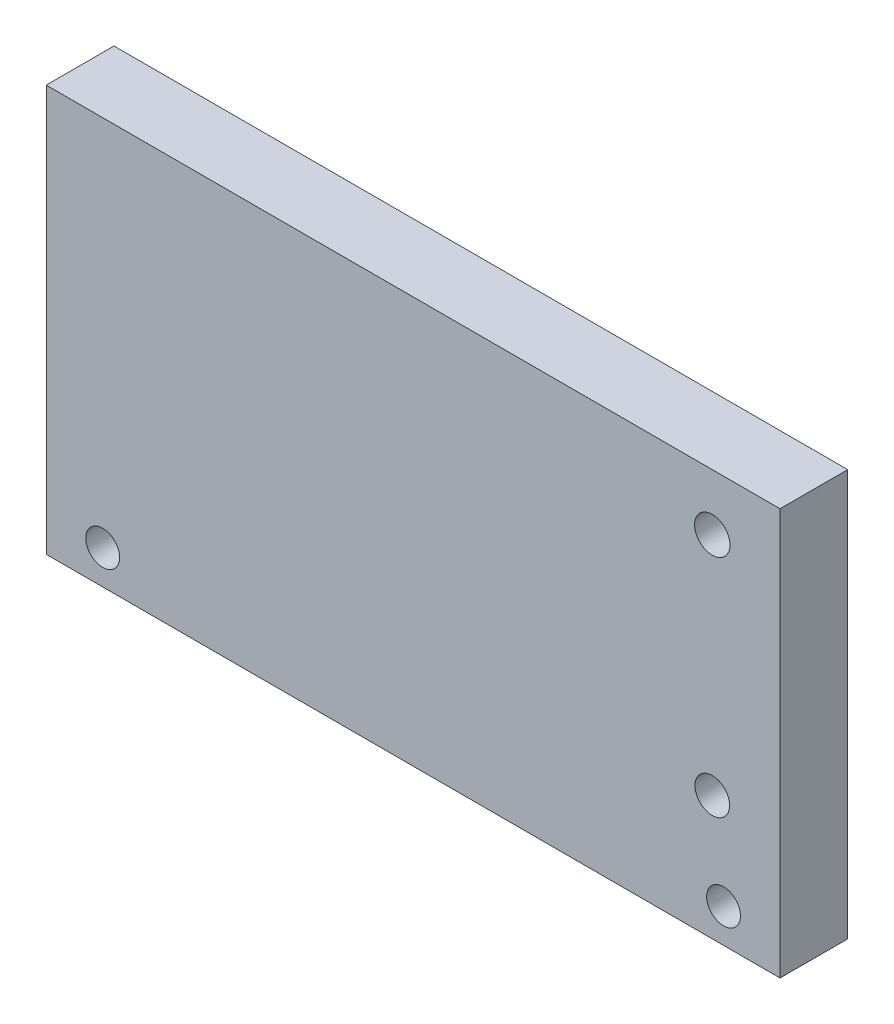
from build123d import *

# Parameters (mm, degrees)
ESQUISSE1_W             = 65
ESQUISSE1_H             = 36
ESQUISSE1_R             = 1.567190536
ESQUISSE1_R_2           = 1.534262692
BOSS_EXTRU_1_DEPTH      = 6
ESQUISSE3_R             = 1.5
ENL_V_MAT_EXTRU_1_DEPTH = 10


with BuildPart() as part:
    # Esquisse1 → Boss.-Extru.1 (new body)
    with BuildSketch(Plane.XY):
        with Locations((-7.771220945, 18.631944444)):
            Rectangle(ESQUISSE1_W, ESQUISSE1_H)
        with Locations((18.728779055, 31.631944444)):
            Circle(ESQUISSE1_R, mode=Mode.SUBTRACT)
        with Locations((18.728779055, 11.631944444)):
            Circle(ESQUISSE1_R_2, mode=Mode.SUBTRACT)
    extrude(amount=BOSS_EXTRU_1_DEPTH)

    # Esquisse3 → Enlèv. mat.-Extru.1 (cut)
    with BuildSketch(Plane.XY.offset(6)):
        with Locations((-35.271220945, 3.631944444)):
            Circle(ESQUISSE3_R)
        with Locations((19.728779055, 3.631944444)):
            Circle(ESQUISSE3_R)
    extrude(amount=-ENL_V_MAT_EXTRU_1_DEPTH, mode=Mode.SUBTRACT)


solid = part.part
